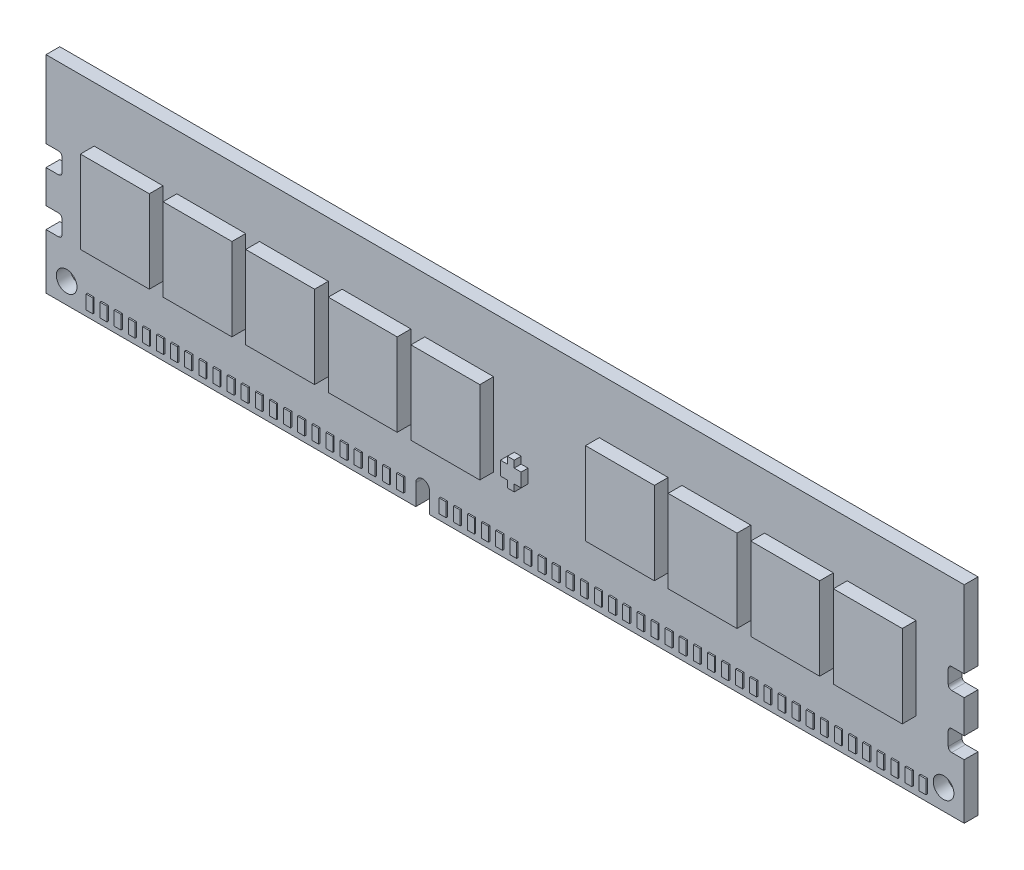
from build123d import *

# Parameters (mm, degrees)
SKETCH1_W                = 133.35
SKETCH1_H                = 30
PCB_DEPTH                = 1
SKETCH2_W                = 2.320505003
SKETCH2_H                = 3
SKETCH2_W_2              = 2
SKETCH2_H_2              = 4
CUT_EXTRUDE1_DEPTH       = 2
F_3_0MM_DOWEL_HOLE1_D    = 3
SKETCH11_W               = 10
SKETCH11_H               = 12
BOSS_EXTRUDE2_DEPTH      = 2
LPATTERN1_COUNT          = 5
LPATTERN1_PITCH          = 12
SKETCH12_W               = 10
SKETCH12_H               = 12
BOSS_EXTRUDE3_DEPTH      = 2
LPATTERN2_COUNT          = 4
LPATTERN2_PITCH          = 12
MIRROR1_COPY_1_SKETCH_W  = 10
MIRROR1_COPY_1_SKETCH_H  = 12
MIRROR1_COPY_1_DEPTH     = 2
MIRROR1_COPY_2_SKETCH_W  = 10
MIRROR1_COPY_2_SKETCH_H  = 12
MIRROR1_COPY_2_DEPTH     = 2
MIRROR1_COPY_3_SKETCH_W  = 10
MIRROR1_COPY_3_SKETCH_H  = 12
MIRROR1_COPY_3_DEPTH     = 2
MIRROR1_COPY_4_SKETCH_W  = 10
MIRROR1_COPY_4_SKETCH_H  = 12
MIRROR1_COPY_4_DEPTH     = 2
MIRROR1_COPY_5_SKETCH_W  = 10
MIRROR1_COPY_5_SKETCH_H  = 12
MIRROR1_COPY_5_DEPTH     = 2
MIRROR1_COPY_6_SKETCH_W  = 10
MIRROR1_COPY_6_SKETCH_H  = 12
MIRROR1_COPY_6_DEPTH     = 2
MIRROR1_COPY_7_SKETCH_W  = 10
MIRROR1_COPY_7_SKETCH_H  = 12
MIRROR1_COPY_7_DEPTH     = 2
SKETCH13_W               = 3
SKETCH13_H               = 2
SKETCH13_W_2             = 1
SKETCH13_H_2             = 1
BOSS_EXTRUDE4_DEPTH      = 1
SKETCH14_W               = 1
SKETCH14_H               = 2
BOSS_EXTRUDE5_DEPTH      = 0.2
LPATTERN3_COUNT          = 23
LPATTERN3_PITCH          = 2.05
SKETCH15_W               = 1
SKETCH15_H               = 2
BOSS_EXTRUDE6_DEPTH      = 0.2
LPATTERN4_COUNT          = 35
LPATTERN4_PITCH          = 2.05
MIRROR2_COPY_1_SKETCH_W  = 1
MIRROR2_COPY_1_SKETCH_H  = 2
MIRROR2_COPY_1_DEPTH     = 0.2
MIRROR2_COPY_2_SKETCH_W  = 1
MIRROR2_COPY_2_SKETCH_H  = 2
MIRROR2_COPY_2_DEPTH     = 0.2
MIRROR2_COPY_3_SKETCH_W  = 1
MIRROR2_COPY_3_SKETCH_H  = 2
MIRROR2_COPY_3_DEPTH     = 0.2
MIRROR2_COPY_4_SKETCH_W  = 1
MIRROR2_COPY_4_SKETCH_H  = 2
MIRROR2_COPY_4_DEPTH     = 0.2
MIRROR2_COPY_5_SKETCH_W  = 1
MIRROR2_COPY_5_SKETCH_H  = 2
MIRROR2_COPY_5_DEPTH     = 0.2
MIRROR2_COPY_6_SKETCH_W  = 1
MIRROR2_COPY_6_SKETCH_H  = 2
MIRROR2_COPY_6_DEPTH     = 0.2
MIRROR2_COPY_7_SKETCH_W  = 1
MIRROR2_COPY_7_SKETCH_H  = 2
MIRROR2_COPY_7_DEPTH     = 0.2
MIRROR2_COPY_8_SKETCH_W  = 1
MIRROR2_COPY_8_SKETCH_H  = 2
MIRROR2_COPY_8_DEPTH     = 0.2
MIRROR2_COPY_9_SKETCH_W  = 1
MIRROR2_COPY_9_SKETCH_H  = 2
MIRROR2_COPY_9_DEPTH     = 0.2
MIRROR2_COPY_10_SKETCH_W = 1
MIRROR2_COPY_10_SKETCH_H = 2
MIRROR2_COPY_10_DEPTH    = 0.2
MIRROR2_COPY_11_SKETCH_W = 1
MIRROR2_COPY_11_SKETCH_H = 2
MIRROR2_COPY_11_DEPTH    = 0.2
MIRROR2_COPY_12_SKETCH_W = 1
MIRROR2_COPY_12_SKETCH_H = 2
MIRROR2_COPY_12_DEPTH    = 0.2
MIRROR2_COPY_13_SKETCH_W = 1
MIRROR2_COPY_13_SKETCH_H = 2
MIRROR2_COPY_13_DEPTH    = 0.2
MIRROR2_COPY_14_SKETCH_W = 1
MIRROR2_COPY_14_SKETCH_H = 2
MIRROR2_COPY_14_DEPTH    = 0.2
MIRROR2_COPY_15_SKETCH_W = 1
MIRROR2_COPY_15_SKETCH_H = 2
MIRROR2_COPY_15_DEPTH    = 0.2
MIRROR2_COPY_16_SKETCH_W = 1
MIRROR2_COPY_16_SKETCH_H = 2
MIRROR2_COPY_16_DEPTH    = 0.2
MIRROR2_COPY_17_SKETCH_W = 1
MIRROR2_COPY_17_SKETCH_H = 2
MIRROR2_COPY_17_DEPTH    = 0.2
MIRROR2_COPY_18_SKETCH_W = 1
MIRROR2_COPY_18_SKETCH_H = 2
MIRROR2_COPY_18_DEPTH    = 0.2
MIRROR2_COPY_19_SKETCH_W = 1
MIRROR2_COPY_19_SKETCH_H = 2
MIRROR2_COPY_19_DEPTH    = 0.2
MIRROR2_COPY_20_SKETCH_W = 1
MIRROR2_COPY_20_SKETCH_H = 2
MIRROR2_COPY_20_DEPTH    = 0.2
MIRROR2_COPY_21_SKETCH_W = 1
MIRROR2_COPY_21_SKETCH_H = 2
MIRROR2_COPY_21_DEPTH    = 0.2
MIRROR2_COPY_22_SKETCH_W = 1
MIRROR2_COPY_22_SKETCH_H = 2
MIRROR2_COPY_22_DEPTH    = 0.2
MIRROR2_COPY_23_SKETCH_W = 1
MIRROR2_COPY_23_SKETCH_H = 2
MIRROR2_COPY_23_DEPTH    = 0.2
MIRROR2_COPY_24_SKETCH_W = 1
MIRROR2_COPY_24_SKETCH_H = 2
MIRROR2_COPY_24_DEPTH    = 0.2
MIRROR2_COPY_25_SKETCH_W = 1
MIRROR2_COPY_25_SKETCH_H = 2
MIRROR2_COPY_25_DEPTH    = 0.2
MIRROR2_COPY_26_SKETCH_W = 1
MIRROR2_COPY_26_SKETCH_H = 2
MIRROR2_COPY_26_DEPTH    = 0.2
MIRROR2_COPY_27_SKETCH_W = 1
MIRROR2_COPY_27_SKETCH_H = 2
MIRROR2_COPY_27_DEPTH    = 0.2
MIRROR2_COPY_28_SKETCH_W = 1
MIRROR2_COPY_28_SKETCH_H = 2
MIRROR2_COPY_28_DEPTH    = 0.2
MIRROR2_COPY_29_SKETCH_W = 1
MIRROR2_COPY_29_SKETCH_H = 2
MIRROR2_COPY_29_DEPTH    = 0.2
MIRROR2_COPY_30_SKETCH_W = 1
MIRROR2_COPY_30_SKETCH_H = 2
MIRROR2_COPY_30_DEPTH    = 0.2
MIRROR2_COPY_31_SKETCH_W = 1
MIRROR2_COPY_31_SKETCH_H = 2
MIRROR2_COPY_31_DEPTH    = 0.2
MIRROR2_COPY_32_SKETCH_W = 1
MIRROR2_COPY_32_SKETCH_H = 2
MIRROR2_COPY_32_DEPTH    = 0.2
MIRROR2_COPY_33_SKETCH_W = 1
MIRROR2_COPY_33_SKETCH_H = 2
MIRROR2_COPY_33_DEPTH    = 0.2
MIRROR2_COPY_34_SKETCH_W = 1
MIRROR2_COPY_34_SKETCH_H = 2
MIRROR2_COPY_34_DEPTH    = 0.2
MIRROR2_COPY_35_SKETCH_W = 1
MIRROR2_COPY_35_SKETCH_H = 2
MIRROR2_COPY_35_DEPTH    = 0.2
MIRROR2_COPY_36_SKETCH_W = 1
MIRROR2_COPY_36_SKETCH_H = 2
MIRROR2_COPY_36_DEPTH    = 0.2
MIRROR2_COPY_37_SKETCH_W = 1
MIRROR2_COPY_37_SKETCH_H = 2
MIRROR2_COPY_37_DEPTH    = 0.2
MIRROR2_COPY_38_SKETCH_W = 1
MIRROR2_COPY_38_SKETCH_H = 2
MIRROR2_COPY_38_DEPTH    = 0.2
MIRROR2_COPY_39_SKETCH_W = 1
MIRROR2_COPY_39_SKETCH_H = 2
MIRROR2_COPY_39_DEPTH    = 0.2
MIRROR2_COPY_40_SKETCH_W = 1
MIRROR2_COPY_40_SKETCH_H = 2
MIRROR2_COPY_40_DEPTH    = 0.2
MIRROR2_COPY_41_SKETCH_W = 1
MIRROR2_COPY_41_SKETCH_H = 2
MIRROR2_COPY_41_DEPTH    = 0.2
MIRROR2_COPY_42_SKETCH_W = 1
MIRROR2_COPY_42_SKETCH_H = 2
MIRROR2_COPY_42_DEPTH    = 0.2
MIRROR2_COPY_43_SKETCH_W = 1
MIRROR2_COPY_43_SKETCH_H = 2
MIRROR2_COPY_43_DEPTH    = 0.2
MIRROR2_COPY_44_SKETCH_W = 1
MIRROR2_COPY_44_SKETCH_H = 2
MIRROR2_COPY_44_DEPTH    = 0.2
MIRROR2_COPY_45_SKETCH_W = 1
MIRROR2_COPY_45_SKETCH_H = 2
MIRROR2_COPY_45_DEPTH    = 0.2
MIRROR2_COPY_46_SKETCH_W = 1
MIRROR2_COPY_46_SKETCH_H = 2
MIRROR2_COPY_46_DEPTH    = 0.2
MIRROR2_COPY_47_SKETCH_W = 1
MIRROR2_COPY_47_SKETCH_H = 2
MIRROR2_COPY_47_DEPTH    = 0.2
MIRROR2_COPY_48_SKETCH_W = 1
MIRROR2_COPY_48_SKETCH_H = 2
MIRROR2_COPY_48_DEPTH    = 0.2
MIRROR2_COPY_49_SKETCH_W = 1
MIRROR2_COPY_49_SKETCH_H = 2
MIRROR2_COPY_49_DEPTH    = 0.2
MIRROR2_COPY_50_SKETCH_W = 1
MIRROR2_COPY_50_SKETCH_H = 2
MIRROR2_COPY_50_DEPTH    = 0.2
MIRROR2_COPY_51_SKETCH_W = 1
MIRROR2_COPY_51_SKETCH_H = 2
MIRROR2_COPY_51_DEPTH    = 0.2
MIRROR2_COPY_52_SKETCH_W = 1
MIRROR2_COPY_52_SKETCH_H = 2
MIRROR2_COPY_52_DEPTH    = 0.2
MIRROR2_COPY_53_SKETCH_W = 1
MIRROR2_COPY_53_SKETCH_H = 2
MIRROR2_COPY_53_DEPTH    = 0.2
MIRROR2_COPY_54_SKETCH_W = 1
MIRROR2_COPY_54_SKETCH_H = 2
MIRROR2_COPY_54_DEPTH    = 0.2
MIRROR2_COPY_55_SKETCH_W = 1
MIRROR2_COPY_55_SKETCH_H = 2
MIRROR2_COPY_55_DEPTH    = 0.2
MIRROR2_COPY_56_SKETCH_W = 1
MIRROR2_COPY_56_SKETCH_H = 2
MIRROR2_COPY_56_DEPTH    = 0.2
FILLET1_R                = 0.5
FILLET2_R                = 1


with BuildPart() as part:
    # Sketch1 → PCB (new, symmetric)
    with BuildSketch(Plane.XY):
        with Locations((66.675, 15)):
            Rectangle(SKETCH1_W, SKETCH1_H)
    extrude(amount=PCB_DEPTH, both=True)

    # Sketch2 → Cut-Extrude1 (cut)
    with BuildSketch(Plane.XY.offset(1)):
        with Locations((1.160252502, 17.3)):
            Rectangle(SKETCH2_W, SKETCH2_H)
        with Locations((1.160252502, 9.5)):
            Rectangle(SKETCH2_W, SKETCH2_H)
        with Locations((132.189747498, 9.5)):
            Rectangle(SKETCH2_W, SKETCH2_H)
        with Locations((132.189747498, 17.3)):
            Rectangle(SKETCH2_W, SKETCH2_H)
        with Locations((54.7, 2)):
            Rectangle(SKETCH2_W_2, SKETCH2_H_2)
    extrude(amount=-CUT_EXTRUDE1_DEPTH, mode=Mode.SUBTRACT)

    # Ø3.0mm Dowel Hole1 (through all)
    with Locations(Plane.XY.offset(1)):
        with Locations((3, 3), (130.35, 3)):
            Hole(F_3_0MM_DOWEL_HOLE1_D / 2)

    # Sketch11 → Boss-Extrude2 (add)
    with BuildSketch(Plane.XY.offset(1)):
        with Locations((12, 16)):
            Rectangle(SKETCH11_W, SKETCH11_H)
    boss_extrude2 = extrude(amount=BOSS_EXTRUDE2_DEPTH)

    # LPattern1: Boss-Extrude2 ×5
    with Locations(*[(i * LPATTERN1_PITCH, 0, 0) for i in range(1, LPATTERN1_COUNT)]):
        add(boss_extrude2)

    # Sketch12 → Boss-Extrude3 (add)
    with BuildSketch(Plane.XY.offset(1)):
        with Locations((121.35, 16)):
            Rectangle(SKETCH12_W, SKETCH12_H)
    boss_extrude3 = extrude(amount=BOSS_EXTRUDE3_DEPTH)

    # LPattern2: Boss-Extrude3 ×4
    with Locations(*[(-i * LPATTERN2_PITCH, 0, 0) for i in range(1, LPATTERN2_COUNT)]):
        add(boss_extrude3)

    # Mirror1: Boss-Extrude2, Boss-Extrude3 across plane
    add(boss_extrude2.mirror(Plane.XY))
    add(boss_extrude3.mirror(Plane.XY))

    # Mirror1 copy 1 sketch → Mirror1 copy 1 (add)
    with BuildSketch(Plane(origin=(12, 0, -1), x_dir=(1, 0, 0), z_dir=(0, 0, -1))):
        with Locations((12, -16)):
            Rectangle(MIRROR1_COPY_1_SKETCH_W, MIRROR1_COPY_1_SKETCH_H)
    extrude(amount=MIRROR1_COPY_1_DEPTH)

    # Mirror1 copy 2 sketch → Mirror1 copy 2 (add)
    with BuildSketch(Plane(origin=(24, 0, -1), x_dir=(1, 0, 0), z_dir=(0, 0, -1))):
        with Locations((12, -16)):
            Rectangle(MIRROR1_COPY_2_SKETCH_W, MIRROR1_COPY_2_SKETCH_H)
    extrude(amount=MIRROR1_COPY_2_DEPTH)

    # Mirror1 copy 3 sketch → Mirror1 copy 3 (add)
    with BuildSketch(Plane(origin=(36, 0, -1), x_dir=(1, 0, 0), z_dir=(0, 0, -1))):
        with Locations((12, -16)):
            Rectangle(MIRROR1_COPY_3_SKETCH_W, MIRROR1_COPY_3_SKETCH_H)
    extrude(amount=MIRROR1_COPY_3_DEPTH)

    # Mirror1 copy 4 sketch → Mirror1 copy 4 (add)
    with BuildSketch(Plane(origin=(48, 0, -1), x_dir=(1, 0, 0), z_dir=(0, 0, -1))):
        with Locations((12, -16)):
            Rectangle(MIRROR1_COPY_4_SKETCH_W, MIRROR1_COPY_4_SKETCH_H)
    extrude(amount=MIRROR1_COPY_4_DEPTH)

    # Mirror1 copy 5 sketch → Mirror1 copy 5 (add)
    with BuildSketch(Plane(origin=(-12, 0, -1), x_dir=(1, 0, 0), z_dir=(0, 0, -1))):
        with Locations((121.35, -16)):
            Rectangle(MIRROR1_COPY_5_SKETCH_W, MIRROR1_COPY_5_SKETCH_H)
    extrude(amount=MIRROR1_COPY_5_DEPTH)

    # Mirror1 copy 6 sketch → Mirror1 copy 6 (add)
    with BuildSketch(Plane(origin=(-24, 0, -1), x_dir=(1, 0, 0), z_dir=(0, 0, -1))):
        with Locations((121.35, -16)):
            Rectangle(MIRROR1_COPY_6_SKETCH_W, MIRROR1_COPY_6_SKETCH_H)
    extrude(amount=MIRROR1_COPY_6_DEPTH)

    # Mirror1 copy 7 sketch → Mirror1 copy 7 (add)
    with BuildSketch(Plane(origin=(-36, 0, -1), x_dir=(1, 0, 0), z_dir=(0, 0, -1))):
        with Locations((121.35, -16)):
            Rectangle(MIRROR1_COPY_7_SKETCH_W, MIRROR1_COPY_7_SKETCH_H)
    extrude(amount=MIRROR1_COPY_7_DEPTH)

    # Sketch13 → Boss-Extrude4 (add)
    with BuildSketch(Plane.XY.offset(1)):
        with Locations((68.5, 12)):
            Rectangle(SKETCH13_W, SKETCH13_H)
        with Locations((68.5, 13.5)):
            Rectangle(SKETCH13_W_2, SKETCH13_H_2)
        with Locations((68.5, 10.5)):
            Rectangle(SKETCH13_W_2, SKETCH13_H_2)
    extrude(amount=BOSS_EXTRUDE4_DEPTH)

    # Sketch14 → Boss-Extrude5 (add)
    with BuildSketch(Plane.XY.offset(1)):
        with Locations((6.5, 2)):
            Rectangle(SKETCH14_W, SKETCH14_H)
    boss_extrude5 = extrude(amount=BOSS_EXTRUDE5_DEPTH)

    # LPattern3: Boss-Extrude5 ×23
    with Locations(*[(i * LPATTERN3_PITCH, 0, 0) for i in range(1, LPATTERN3_COUNT)]):
        add(boss_extrude5)

    # Sketch15 → Boss-Extrude6 (add)
    with BuildSketch(Plane.XY.offset(1)):
        with Locations((57.8, 2)):
            Rectangle(SKETCH15_W, SKETCH15_H)
    boss_extrude6 = extrude(amount=BOSS_EXTRUDE6_DEPTH)

    # LPattern4: Boss-Extrude6 ×35
    with Locations(*[(i * LPATTERN4_PITCH, 0, 0) for i in range(1, LPATTERN4_COUNT)]):
        add(boss_extrude6)

    # Mirror2: Boss-Extrude5, Boss-Extrude6 across plane
    add(boss_extrude5.mirror(Plane.XY))
    add(boss_extrude6.mirror(Plane.XY))

    # Mirror2 copy 1 sketch → Mirror2 copy 1 (add)
    with BuildSketch(Plane(origin=(2.05, 0, -1), x_dir=(1, 0, 0), z_dir=(0, 0, -1))):
        with Locations((6.5, -2)):
            Rectangle(MIRROR2_COPY_1_SKETCH_W, MIRROR2_COPY_1_SKETCH_H)
    extrude(amount=MIRROR2_COPY_1_DEPTH)

    # Mirror2 copy 2 sketch → Mirror2 copy 2 (add)
    with BuildSketch(Plane(origin=(4.1, 0, -1), x_dir=(1, 0, 0), z_dir=(0, 0, -1))):
        with Locations((6.5, -2)):
            Rectangle(MIRROR2_COPY_2_SKETCH_W, MIRROR2_COPY_2_SKETCH_H)
    extrude(amount=MIRROR2_COPY_2_DEPTH)

    # Mirror2 copy 3 sketch → Mirror2 copy 3 (add)
    with BuildSketch(Plane(origin=(6.15, 0, -1), x_dir=(1, 0, 0), z_dir=(0, 0, -1))):
        with Locations((6.5, -2)):
            Rectangle(MIRROR2_COPY_3_SKETCH_W, MIRROR2_COPY_3_SKETCH_H)
    extrude(amount=MIRROR2_COPY_3_DEPTH)

    # Mirror2 copy 4 sketch → Mirror2 copy 4 (add)
    with BuildSketch(Plane(origin=(8.2, 0, -1), x_dir=(1, 0, 0), z_dir=(0, 0, -1))):
        with Locations((6.5, -2)):
            Rectangle(MIRROR2_COPY_4_SKETCH_W, MIRROR2_COPY_4_SKETCH_H)
    extrude(amount=MIRROR2_COPY_4_DEPTH)

    # Mirror2 copy 5 sketch → Mirror2 copy 5 (add)
    with BuildSketch(Plane(origin=(10.25, 0, -1), x_dir=(1, 0, 0), z_dir=(0, 0, -1))):
        with Locations((6.5, -2)):
            Rectangle(MIRROR2_COPY_5_SKETCH_W, MIRROR2_COPY_5_SKETCH_H)
    extrude(amount=MIRROR2_COPY_5_DEPTH)

    # Mirror2 copy 6 sketch → Mirror2 copy 6 (add)
    with BuildSketch(Plane(origin=(12.3, 0, -1), x_dir=(1, 0, 0), z_dir=(0, 0, -1))):
        with Locations((6.5, -2)):
            Rectangle(MIRROR2_COPY_6_SKETCH_W, MIRROR2_COPY_6_SKETCH_H)
    extrude(amount=MIRROR2_COPY_6_DEPTH)

    # Mirror2 copy 7 sketch → Mirror2 copy 7 (add)
    with BuildSketch(Plane(origin=(14.35, 0, -1), x_dir=(1, 0, 0), z_dir=(0, 0, -1))):
        with Locations((6.5, -2)):
            Rectangle(MIRROR2_COPY_7_SKETCH_W, MIRROR2_COPY_7_SKETCH_H)
    extrude(amount=MIRROR2_COPY_7_DEPTH)

    # Mirror2 copy 8 sketch → Mirror2 copy 8 (add)
    with BuildSketch(Plane(origin=(16.4, 0, -1), x_dir=(1, 0, 0), z_dir=(0, 0, -1))):
        with Locations((6.5, -2)):
            Rectangle(MIRROR2_COPY_8_SKETCH_W, MIRROR2_COPY_8_SKETCH_H)
    extrude(amount=MIRROR2_COPY_8_DEPTH)

    # Mirror2 copy 9 sketch → Mirror2 copy 9 (add)
    with BuildSketch(Plane(origin=(18.45, 0, -1), x_dir=(1, 0, 0), z_dir=(0, 0, -1))):
        with Locations((6.5, -2)):
            Rectangle(MIRROR2_COPY_9_SKETCH_W, MIRROR2_COPY_9_SKETCH_H)
    extrude(amount=MIRROR2_COPY_9_DEPTH)

    # Mirror2 copy 10 sketch → Mirror2 copy 10 (add)
    with BuildSketch(Plane(origin=(20.5, 0, -1), x_dir=(1, 0, 0), z_dir=(0, 0, -1))):
        with Locations((6.5, -2)):
            Rectangle(MIRROR2_COPY_10_SKETCH_W, MIRROR2_COPY_10_SKETCH_H)
    extrude(amount=MIRROR2_COPY_10_DEPTH)

    # Mirror2 copy 11 sketch → Mirror2 copy 11 (add)
    with BuildSketch(Plane(origin=(22.55, 0, -1), x_dir=(1, 0, 0), z_dir=(0, 0, -1))):
        with Locations((6.5, -2)):
            Rectangle(MIRROR2_COPY_11_SKETCH_W, MIRROR2_COPY_11_SKETCH_H)
    extrude(amount=MIRROR2_COPY_11_DEPTH)

    # Mirror2 copy 12 sketch → Mirror2 copy 12 (add)
    with BuildSketch(Plane(origin=(24.6, 0, -1), x_dir=(1, 0, 0), z_dir=(0, 0, -1))):
        with Locations((6.5, -2)):
            Rectangle(MIRROR2_COPY_12_SKETCH_W, MIRROR2_COPY_12_SKETCH_H)
    extrude(amount=MIRROR2_COPY_12_DEPTH)

    # Mirror2 copy 13 sketch → Mirror2 copy 13 (add)
    with BuildSketch(Plane(origin=(26.65, 0, -1), x_dir=(1, 0, 0), z_dir=(0, 0, -1))):
        with Locations((6.5, -2)):
            Rectangle(MIRROR2_COPY_13_SKETCH_W, MIRROR2_COPY_13_SKETCH_H)
    extrude(amount=MIRROR2_COPY_13_DEPTH)

    # Mirror2 copy 14 sketch → Mirror2 copy 14 (add)
    with BuildSketch(Plane(origin=(28.7, 0, -1), x_dir=(1, 0, 0), z_dir=(0, 0, -1))):
        with Locations((6.5, -2)):
            Rectangle(MIRROR2_COPY_14_SKETCH_W, MIRROR2_COPY_14_SKETCH_H)
    extrude(amount=MIRROR2_COPY_14_DEPTH)

    # Mirror2 copy 15 sketch → Mirror2 copy 15 (add)
    with BuildSketch(Plane(origin=(30.75, 0, -1), x_dir=(1, 0, 0), z_dir=(0, 0, -1))):
        with Locations((6.5, -2)):
            Rectangle(MIRROR2_COPY_15_SKETCH_W, MIRROR2_COPY_15_SKETCH_H)
    extrude(amount=MIRROR2_COPY_15_DEPTH)

    # Mirror2 copy 16 sketch → Mirror2 copy 16 (add)
    with BuildSketch(Plane(origin=(32.8, 0, -1), x_dir=(1, 0, 0), z_dir=(0, 0, -1))):
        with Locations((6.5, -2)):
            Rectangle(MIRROR2_COPY_16_SKETCH_W, MIRROR2_COPY_16_SKETCH_H)
    extrude(amount=MIRROR2_COPY_16_DEPTH)

    # Mirror2 copy 17 sketch → Mirror2 copy 17 (add)
    with BuildSketch(Plane(origin=(34.85, 0, -1), x_dir=(1, 0, 0), z_dir=(0, 0, -1))):
        with Locations((6.5, -2)):
            Rectangle(MIRROR2_COPY_17_SKETCH_W, MIRROR2_COPY_17_SKETCH_H)
    extrude(amount=MIRROR2_COPY_17_DEPTH)

    # Mirror2 copy 18 sketch → Mirror2 copy 18 (add)
    with BuildSketch(Plane(origin=(36.9, 0, -1), x_dir=(1, 0, 0), z_dir=(0, 0, -1))):
        with Locations((6.5, -2)):
            Rectangle(MIRROR2_COPY_18_SKETCH_W, MIRROR2_COPY_18_SKETCH_H)
    extrude(amount=MIRROR2_COPY_18_DEPTH)

    # Mirror2 copy 19 sketch → Mirror2 copy 19 (add)
    with BuildSketch(Plane(origin=(38.95, 0, -1), x_dir=(1, 0, 0), z_dir=(0, 0, -1))):
        with Locations((6.5, -2)):
            Rectangle(MIRROR2_COPY_19_SKETCH_W, MIRROR2_COPY_19_SKETCH_H)
    extrude(amount=MIRROR2_COPY_19_DEPTH)

    # Mirror2 copy 20 sketch → Mirror2 copy 20 (add)
    with BuildSketch(Plane(origin=(41, 0, -1), x_dir=(1, 0, 0), z_dir=(0, 0, -1))):
        with Locations((6.5, -2)):
            Rectangle(MIRROR2_COPY_20_SKETCH_W, MIRROR2_COPY_20_SKETCH_H)
    extrude(amount=MIRROR2_COPY_20_DEPTH)

    # Mirror2 copy 21 sketch → Mirror2 copy 21 (add)
    with BuildSketch(Plane(origin=(43.05, 0, -1), x_dir=(1, 0, 0), z_dir=(0, 0, -1))):
        with Locations((6.5, -2)):
            Rectangle(MIRROR2_COPY_21_SKETCH_W, MIRROR2_COPY_21_SKETCH_H)
    extrude(amount=MIRROR2_COPY_21_DEPTH)

    # Mirror2 copy 22 sketch → Mirror2 copy 22 (add)
    with BuildSketch(Plane(origin=(45.1, 0, -1), x_dir=(1, 0, 0), z_dir=(0, 0, -1))):
        with Locations((6.5, -2)):
            Rectangle(MIRROR2_COPY_22_SKETCH_W, MIRROR2_COPY_22_SKETCH_H)
    extrude(amount=MIRROR2_COPY_22_DEPTH)

    # Mirror2 copy 23 sketch → Mirror2 copy 23 (add)
    with BuildSketch(Plane(origin=(2.05, 0, -1), x_dir=(1, 0, 0), z_dir=(0, 0, -1))):
        with Locations((57.8, -2)):
            Rectangle(MIRROR2_COPY_23_SKETCH_W, MIRROR2_COPY_23_SKETCH_H)
    extrude(amount=MIRROR2_COPY_23_DEPTH)

    # Mirror2 copy 24 sketch → Mirror2 copy 24 (add)
    with BuildSketch(Plane(origin=(4.1, 0, -1), x_dir=(1, 0, 0), z_dir=(0, 0, -1))):
        with Locations((57.8, -2)):
            Rectangle(MIRROR2_COPY_24_SKETCH_W, MIRROR2_COPY_24_SKETCH_H)
    extrude(amount=MIRROR2_COPY_24_DEPTH)

    # Mirror2 copy 25 sketch → Mirror2 copy 25 (add)
    with BuildSketch(Plane(origin=(6.15, 0, -1), x_dir=(1, 0, 0), z_dir=(0, 0, -1))):
        with Locations((57.8, -2)):
            Rectangle(MIRROR2_COPY_25_SKETCH_W, MIRROR2_COPY_25_SKETCH_H)
    extrude(amount=MIRROR2_COPY_25_DEPTH)

    # Mirror2 copy 26 sketch → Mirror2 copy 26 (add)
    with BuildSketch(Plane(origin=(8.2, 0, -1), x_dir=(1, 0, 0), z_dir=(0, 0, -1))):
        with Locations((57.8, -2)):
            Rectangle(MIRROR2_COPY_26_SKETCH_W, MIRROR2_COPY_26_SKETCH_H)
    extrude(amount=MIRROR2_COPY_26_DEPTH)

    # Mirror2 copy 27 sketch → Mirror2 copy 27 (add)
    with BuildSketch(Plane(origin=(10.25, 0, -1), x_dir=(1, 0, 0), z_dir=(0, 0, -1))):
        with Locations((57.8, -2)):
            Rectangle(MIRROR2_COPY_27_SKETCH_W, MIRROR2_COPY_27_SKETCH_H)
    extrude(amount=MIRROR2_COPY_27_DEPTH)

    # Mirror2 copy 28 sketch → Mirror2 copy 28 (add)
    with BuildSketch(Plane(origin=(12.3, 0, -1), x_dir=(1, 0, 0), z_dir=(0, 0, -1))):
        with Locations((57.8, -2)):
            Rectangle(MIRROR2_COPY_28_SKETCH_W, MIRROR2_COPY_28_SKETCH_H)
    extrude(amount=MIRROR2_COPY_28_DEPTH)

    # Mirror2 copy 29 sketch → Mirror2 copy 29 (add)
    with BuildSketch(Plane(origin=(14.35, 0, -1), x_dir=(1, 0, 0), z_dir=(0, 0, -1))):
        with Locations((57.8, -2)):
            Rectangle(MIRROR2_COPY_29_SKETCH_W, MIRROR2_COPY_29_SKETCH_H)
    extrude(amount=MIRROR2_COPY_29_DEPTH)

    # Mirror2 copy 30 sketch → Mirror2 copy 30 (add)
    with BuildSketch(Plane(origin=(16.4, 0, -1), x_dir=(1, 0, 0), z_dir=(0, 0, -1))):
        with Locations((57.8, -2)):
            Rectangle(MIRROR2_COPY_30_SKETCH_W, MIRROR2_COPY_30_SKETCH_H)
    extrude(amount=MIRROR2_COPY_30_DEPTH)

    # Mirror2 copy 31 sketch → Mirror2 copy 31 (add)
    with BuildSketch(Plane(origin=(18.45, 0, -1), x_dir=(1, 0, 0), z_dir=(0, 0, -1))):
        with Locations((57.8, -2)):
            Rectangle(MIRROR2_COPY_31_SKETCH_W, MIRROR2_COPY_31_SKETCH_H)
    extrude(amount=MIRROR2_COPY_31_DEPTH)

    # Mirror2 copy 32 sketch → Mirror2 copy 32 (add)
    with BuildSketch(Plane(origin=(20.5, 0, -1), x_dir=(1, 0, 0), z_dir=(0, 0, -1))):
        with Locations((57.8, -2)):
            Rectangle(MIRROR2_COPY_32_SKETCH_W, MIRROR2_COPY_32_SKETCH_H)
    extrude(amount=MIRROR2_COPY_32_DEPTH)

    # Mirror2 copy 33 sketch → Mirror2 copy 33 (add)
    with BuildSketch(Plane(origin=(22.55, 0, -1), x_dir=(1, 0, 0), z_dir=(0, 0, -1))):
        with Locations((57.8, -2)):
            Rectangle(MIRROR2_COPY_33_SKETCH_W, MIRROR2_COPY_33_SKETCH_H)
    extrude(amount=MIRROR2_COPY_33_DEPTH)

    # Mirror2 copy 34 sketch → Mirror2 copy 34 (add)
    with BuildSketch(Plane(origin=(24.6, 0, -1), x_dir=(1, 0, 0), z_dir=(0, 0, -1))):
        with Locations((57.8, -2)):
            Rectangle(MIRROR2_COPY_34_SKETCH_W, MIRROR2_COPY_34_SKETCH_H)
    extrude(amount=MIRROR2_COPY_34_DEPTH)

    # Mirror2 copy 35 sketch → Mirror2 copy 35 (add)
    with BuildSketch(Plane(origin=(26.65, 0, -1), x_dir=(1, 0, 0), z_dir=(0, 0, -1))):
        with Locations((57.8, -2)):
            Rectangle(MIRROR2_COPY_35_SKETCH_W, MIRROR2_COPY_35_SKETCH_H)
    extrude(amount=MIRROR2_COPY_35_DEPTH)

    # Mirror2 copy 36 sketch → Mirror2 copy 36 (add)
    with BuildSketch(Plane(origin=(28.7, 0, -1), x_dir=(1, 0, 0), z_dir=(0, 0, -1))):
        with Locations((57.8, -2)):
            Rectangle(MIRROR2_COPY_36_SKETCH_W, MIRROR2_COPY_36_SKETCH_H)
    extrude(amount=MIRROR2_COPY_36_DEPTH)

    # Mirror2 copy 37 sketch → Mirror2 copy 37 (add)
    with BuildSketch(Plane(origin=(30.75, 0, -1), x_dir=(1, 0, 0), z_dir=(0, 0, -1))):
        with Locations((57.8, -2)):
            Rectangle(MIRROR2_COPY_37_SKETCH_W, MIRROR2_COPY_37_SKETCH_H)
    extrude(amount=MIRROR2_COPY_37_DEPTH)

    # Mirror2 copy 38 sketch → Mirror2 copy 38 (add)
    with BuildSketch(Plane(origin=(32.8, 0, -1), x_dir=(1, 0, 0), z_dir=(0, 0, -1))):
        with Locations((57.8, -2)):
            Rectangle(MIRROR2_COPY_38_SKETCH_W, MIRROR2_COPY_38_SKETCH_H)
    extrude(amount=MIRROR2_COPY_38_DEPTH)

    # Mirror2 copy 39 sketch → Mirror2 copy 39 (add)
    with BuildSketch(Plane(origin=(34.85, 0, -1), x_dir=(1, 0, 0), z_dir=(0, 0, -1))):
        with Locations((57.8, -2)):
            Rectangle(MIRROR2_COPY_39_SKETCH_W, MIRROR2_COPY_39_SKETCH_H)
    extrude(amount=MIRROR2_COPY_39_DEPTH)

    # Mirror2 copy 40 sketch → Mirror2 copy 40 (add)
    with BuildSketch(Plane(origin=(36.9, 0, -1), x_dir=(1, 0, 0), z_dir=(0, 0, -1))):
        with Locations((57.8, -2)):
            Rectangle(MIRROR2_COPY_40_SKETCH_W, MIRROR2_COPY_40_SKETCH_H)
    extrude(amount=MIRROR2_COPY_40_DEPTH)

    # Mirror2 copy 41 sketch → Mirror2 copy 41 (add)
    with BuildSketch(Plane(origin=(38.95, 0, -1), x_dir=(1, 0, 0), z_dir=(0, 0, -1))):
        with Locations((57.8, -2)):
            Rectangle(MIRROR2_COPY_41_SKETCH_W, MIRROR2_COPY_41_SKETCH_H)
    extrude(amount=MIRROR2_COPY_41_DEPTH)

    # Mirror2 copy 42 sketch → Mirror2 copy 42 (add)
    with BuildSketch(Plane(origin=(41, 0, -1), x_dir=(1, 0, 0), z_dir=(0, 0, -1))):
        with Locations((57.8, -2)):
            Rectangle(MIRROR2_COPY_42_SKETCH_W, MIRROR2_COPY_42_SKETCH_H)
    extrude(amount=MIRROR2_COPY_42_DEPTH)

    # Mirror2 copy 43 sketch → Mirror2 copy 43 (add)
    with BuildSketch(Plane(origin=(43.05, 0, -1), x_dir=(1, 0, 0), z_dir=(0, 0, -1))):
        with Locations((57.8, -2)):
            Rectangle(MIRROR2_COPY_43_SKETCH_W, MIRROR2_COPY_43_SKETCH_H)
    extrude(amount=MIRROR2_COPY_43_DEPTH)

    # Mirror2 copy 44 sketch → Mirror2 copy 44 (add)
    with BuildSketch(Plane(origin=(45.1, 0, -1), x_dir=(1, 0, 0), z_dir=(0, 0, -1))):
        with Locations((57.8, -2)):
            Rectangle(MIRROR2_COPY_44_SKETCH_W, MIRROR2_COPY_44_SKETCH_H)
    extrude(amount=MIRROR2_COPY_44_DEPTH)

    # Mirror2 copy 45 sketch → Mirror2 copy 45 (add)
    with BuildSketch(Plane(origin=(47.15, 0, -1), x_dir=(1, 0, 0), z_dir=(0, 0, -1))):
        with Locations((57.8, -2)):
            Rectangle(MIRROR2_COPY_45_SKETCH_W, MIRROR2_COPY_45_SKETCH_H)
    extrude(amount=MIRROR2_COPY_45_DEPTH)

    # Mirror2 copy 46 sketch → Mirror2 copy 46 (add)
    with BuildSketch(Plane(origin=(49.2, 0, -1), x_dir=(1, 0, 0), z_dir=(0, 0, -1))):
        with Locations((57.8, -2)):
            Rectangle(MIRROR2_COPY_46_SKETCH_W, MIRROR2_COPY_46_SKETCH_H)
    extrude(amount=MIRROR2_COPY_46_DEPTH)

    # Mirror2 copy 47 sketch → Mirror2 copy 47 (add)
    with BuildSketch(Plane(origin=(51.25, 0, -1), x_dir=(1, 0, 0), z_dir=(0, 0, -1))):
        with Locations((57.8, -2)):
            Rectangle(MIRROR2_COPY_47_SKETCH_W, MIRROR2_COPY_47_SKETCH_H)
    extrude(amount=MIRROR2_COPY_47_DEPTH)

    # Mirror2 copy 48 sketch → Mirror2 copy 48 (add)
    with BuildSketch(Plane(origin=(53.3, 0, -1), x_dir=(1, 0, 0), z_dir=(0, 0, -1))):
        with Locations((57.8, -2)):
            Rectangle(MIRROR2_COPY_48_SKETCH_W, MIRROR2_COPY_48_SKETCH_H)
    extrude(amount=MIRROR2_COPY_48_DEPTH)

    # Mirror2 copy 49 sketch → Mirror2 copy 49 (add)
    with BuildSketch(Plane(origin=(55.35, 0, -1), x_dir=(1, 0, 0), z_dir=(0, 0, -1))):
        with Locations((57.8, -2)):
            Rectangle(MIRROR2_COPY_49_SKETCH_W, MIRROR2_COPY_49_SKETCH_H)
    extrude(amount=MIRROR2_COPY_49_DEPTH)

    # Mirror2 copy 50 sketch → Mirror2 copy 50 (add)
    with BuildSketch(Plane(origin=(57.4, 0, -1), x_dir=(1, 0, 0), z_dir=(0, 0, -1))):
        with Locations((57.8, -2)):
            Rectangle(MIRROR2_COPY_50_SKETCH_W, MIRROR2_COPY_50_SKETCH_H)
    extrude(amount=MIRROR2_COPY_50_DEPTH)

    # Mirror2 copy 51 sketch → Mirror2 copy 51 (add)
    with BuildSketch(Plane(origin=(59.45, 0, -1), x_dir=(1, 0, 0), z_dir=(0, 0, -1))):
        with Locations((57.8, -2)):
            Rectangle(MIRROR2_COPY_51_SKETCH_W, MIRROR2_COPY_51_SKETCH_H)
    extrude(amount=MIRROR2_COPY_51_DEPTH)

    # Mirror2 copy 52 sketch → Mirror2 copy 52 (add)
    with BuildSketch(Plane(origin=(61.5, 0, -1), x_dir=(1, 0, 0), z_dir=(0, 0, -1))):
        with Locations((57.8, -2)):
            Rectangle(MIRROR2_COPY_52_SKETCH_W, MIRROR2_COPY_52_SKETCH_H)
    extrude(amount=MIRROR2_COPY_52_DEPTH)

    # Mirror2 copy 53 sketch → Mirror2 copy 53 (add)
    with BuildSketch(Plane(origin=(63.55, 0, -1), x_dir=(1, 0, 0), z_dir=(0, 0, -1))):
        with Locations((57.8, -2)):
            Rectangle(MIRROR2_COPY_53_SKETCH_W, MIRROR2_COPY_53_SKETCH_H)
    extrude(amount=MIRROR2_COPY_53_DEPTH)

    # Mirror2 copy 54 sketch → Mirror2 copy 54 (add)
    with BuildSketch(Plane(origin=(65.6, 0, -1), x_dir=(1, 0, 0), z_dir=(0, 0, -1))):
        with Locations((57.8, -2)):
            Rectangle(MIRROR2_COPY_54_SKETCH_W, MIRROR2_COPY_54_SKETCH_H)
    extrude(amount=MIRROR2_COPY_54_DEPTH)

    # Mirror2 copy 55 sketch → Mirror2 copy 55 (add)
    with BuildSketch(Plane(origin=(67.65, 0, -1), x_dir=(1, 0, 0), z_dir=(0, 0, -1))):
        with Locations((57.8, -2)):
            Rectangle(MIRROR2_COPY_55_SKETCH_W, MIRROR2_COPY_55_SKETCH_H)
    extrude(amount=MIRROR2_COPY_55_DEPTH)

    # Mirror2 copy 56 sketch → Mirror2 copy 56 (add)
    with BuildSketch(Plane(origin=(69.7, 0, -1), x_dir=(1, 0, 0), z_dir=(0, 0, -1))):
        with Locations((57.8, -2)):
            Rectangle(MIRROR2_COPY_56_SKETCH_W, MIRROR2_COPY_56_SKETCH_H)
    extrude(amount=MIRROR2_COPY_56_DEPTH)

    # Fillet1
    fillet1_edges = [part.edges().sort_by_distance(p)[0] for p in [
        (2.320505003, 11, 0),
        (2.320505003, 8, 0),
        (131.029494997, 11, 0),
        (131.029494997, 8, 0),
        (131.029494997, 18.8, 0),
        (131.029494997, 15.8, 0),
        (2.320505003, 18.8, 0),
        (2.320505003, 15.8, 0),
    ]]
    fillet(fillet1_edges, radius=FILLET1_R)

    # Fillet2
    fillet2_edges = [part.edges().sort_by_distance(p)[0] for p in [
        (53.7, 4, 0),
        (55.7, 4, 0),
    ]]
    fillet(fillet2_edges, radius=FILLET2_R - 0.0001)  # a hair under: the kernel refuses the full size


solid = part.part
